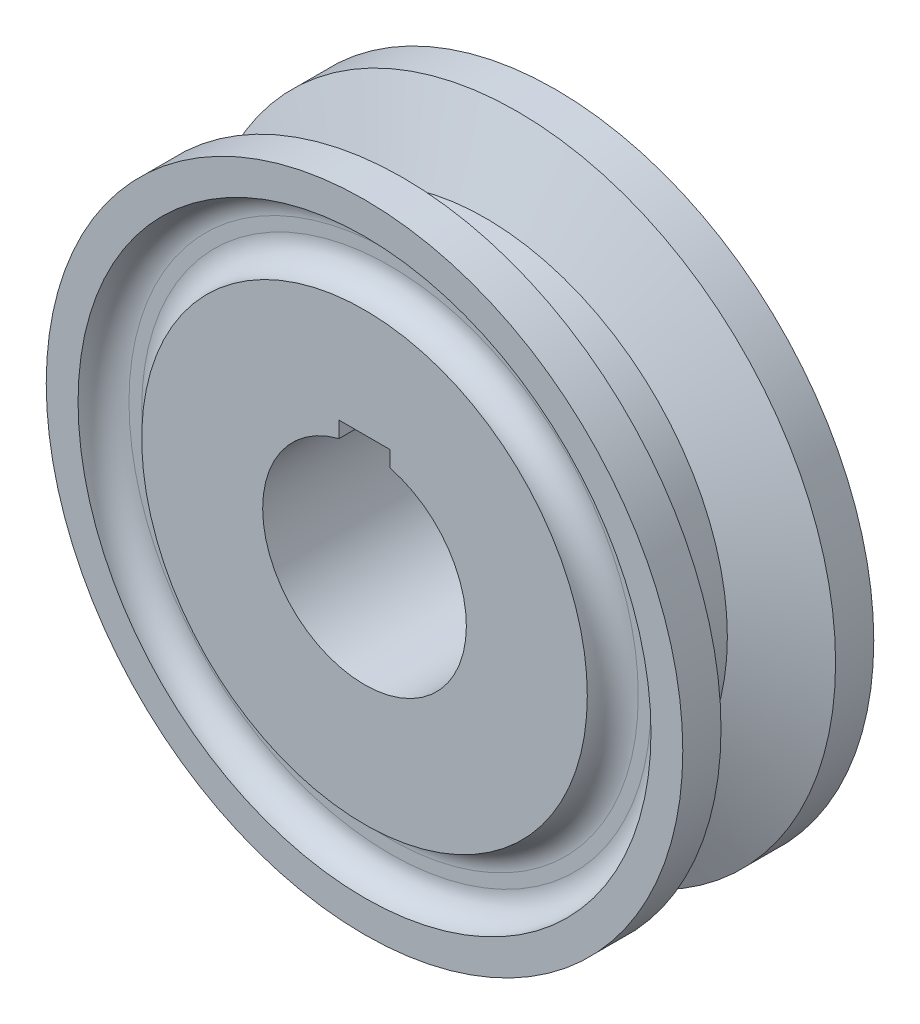
from build123d import *

# Parameters (mm, degrees)
CUT_EXTRUDE1_DEPTH = 39.405728739
SKETCH3_R          = 22.5
SKETCH3_R_2        = 17.5
CUT_EXTRUDE2_DEPTH = 2
CUT_EXTRUDE3_START = -2
SKETCH4_R          = 22.5
SKETCH4_R_2        = 17.5
CUT_EXTRUDE3_DEPTH = 2
FILLET1_R          = 2


with BuildPart() as part:
    # Sketch1 → Revolve1 (revolve)
    with BuildSketch(Plane(origin=(0, 0, 0), x_dir=(0, 0, -1), z_dir=(1, 0, 0)), mode=Mode.PRIVATE) as revolve1_sk:
        Polygon((4.5, 25), (7.5, 25), (7.5, 0), (0, 0), (-7.5, 0), (-7.5, 25), (-4.5, 25), (-2, 19), (2, 19), align=None)
    revolve(revolve1_sk.sketch.rotate(Axis((0, 0, 350.137387165), (0, 0, -1)), 90), axis=Axis((0, 0, 350.137387165), (0, 0, -1)))

    # Sketch2 → Cut-Extrude1 (cut, through all)
    with BuildSketch(Plane.XY.offset(7.5)):
        with BuildLine():
            Line((-2, 9), (2, 9))
            Line((2, 9), (2, 7.745966692))
            ThreePointArc((2, 7.745966692), (0, -8), (-2, 7.745966692))
            Line((-2, 7.745966692), (-2, 9))
        make_face()
    extrude(amount=-CUT_EXTRUDE1_DEPTH, mode=Mode.SUBTRACT)

    # Sketch3 → Cut-Extrude2 (cut)
    with BuildSketch(Plane.XY.offset(7.5)):
        Circle(SKETCH3_R)
        Circle(SKETCH3_R_2, mode=Mode.SUBTRACT)
    extrude(amount=-CUT_EXTRUDE2_DEPTH, mode=Mode.SUBTRACT)

    # Sketch4 → Cut-Extrude3 (cut)
    with BuildSketch(Plane(origin=(0, 0, -7.5), x_dir=(-1, 0, 0), z_dir=(0, 0, -1)).offset(CUT_EXTRUDE3_START)):
        with Locations(Location((0, 0, 0), (0, 0, 180))):
            Circle(SKETCH4_R)
        with Locations(Location((0, 0, 0), (0, 0, 180))):
            Circle(SKETCH4_R_2, mode=Mode.SUBTRACT)
    extrude(amount=CUT_EXTRUDE3_DEPTH, mode=Mode.SUBTRACT)

    # Fillet1
    fillet1_edges = [part.edges().sort_by_distance(p)[0] for p in [
        (-22.5, 0, 5.5),
        (-17.5, 0, 5.5),
        (-22.5, 0, -5.5),
        (-17.5, 0, -5.5),
    ]]
    fillet(fillet1_edges, radius=FILLET1_R - 0.0001)  # a hair under: the kernel refuses the full size


solid = part.part
